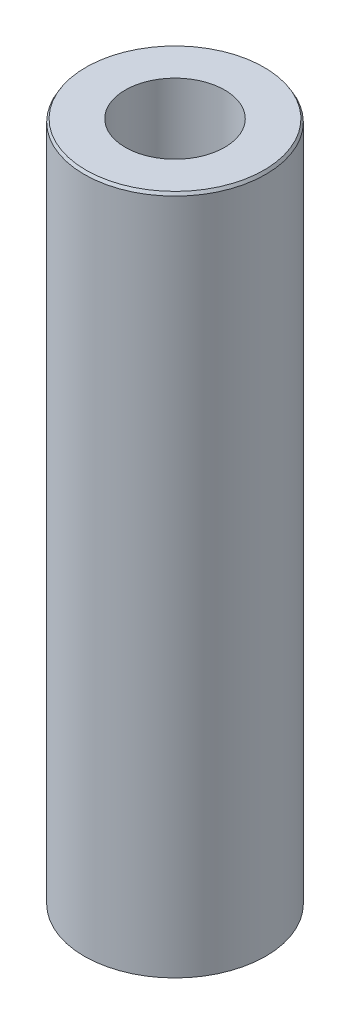
from build123d import *
from OCP.BRepFilletAPI import BRepFilletAPI_MakeChamfer

# Parameters (mm, degrees)
SKETCH1_R           = 57.5
BOSS_EXTRUDE1_DEPTH = 431.863019669
SKETCH2_R           = 31.499875371
CUT_EXTRUDE1_DEPTH  = 440.452122259
CHAMFER1_SIZE       = 1.843122711
CHAMFER1_SIZE2      = 1.064127393


with BuildPart() as part:
    # Sketch1 → Boss-Extrude1 (new body)
    with BuildSketch(Plane(origin=(0, 0, 0), x_dir=(1, 0, 0), z_dir=(0, 1, 0))):
        Circle(SKETCH1_R)
    extrude(amount=BOSS_EXTRUDE1_DEPTH)

    # Sketch2 → Cut-Extrude1 (cut, through all)
    with BuildSketch(Plane(origin=(0, 0, 0), x_dir=(1, 0, 0), z_dir=(0, 1, 0))):
        Circle(SKETCH2_R)
    extrude(amount=CUT_EXTRUDE1_DEPTH, mode=Mode.SUBTRACT)

    # Chamfer1: one chamfer whose edges measure the first distance from different faces: ONE call of the kernel's chamfer builder (chamfer() names one face for all edges)
    chamfer1_edges_1 = [part.edges().sort_by_distance(p)[0] for p in [
        (-57.5, 431.863019669, 0),
    ]]
    chamfer1_side_1 = [part.faces().sort_by_distance(p)[0] for p in [
        (-57.5, 215.931509835, 0),
    ]]
    chamfer1_edges_2 = [part.edges().sort_by_distance(p)[0] for p in [
        (-57.5, 0, 0),
    ]]
    chamfer1_side_2 = [part.faces().sort_by_distance(p)[0] for p in [
        (-55.873654403, 0, 0),
    ]]
    chamfer1 = BRepFilletAPI_MakeChamfer(part.part.solid().wrapped)
    for e in chamfer1_edges_1:
        chamfer1.Add(CHAMFER1_SIZE, CHAMFER1_SIZE2, e.wrapped, chamfer1_side_1[0].wrapped)  # the first distance lies on this face
    for e in chamfer1_edges_2:
        chamfer1.Add(CHAMFER1_SIZE, CHAMFER1_SIZE2, e.wrapped, chamfer1_side_2[0].wrapped)  # the first distance lies on this face
    add(Compound.cast(chamfer1.Shape()), mode=Mode.REPLACE)


solid = part.part
